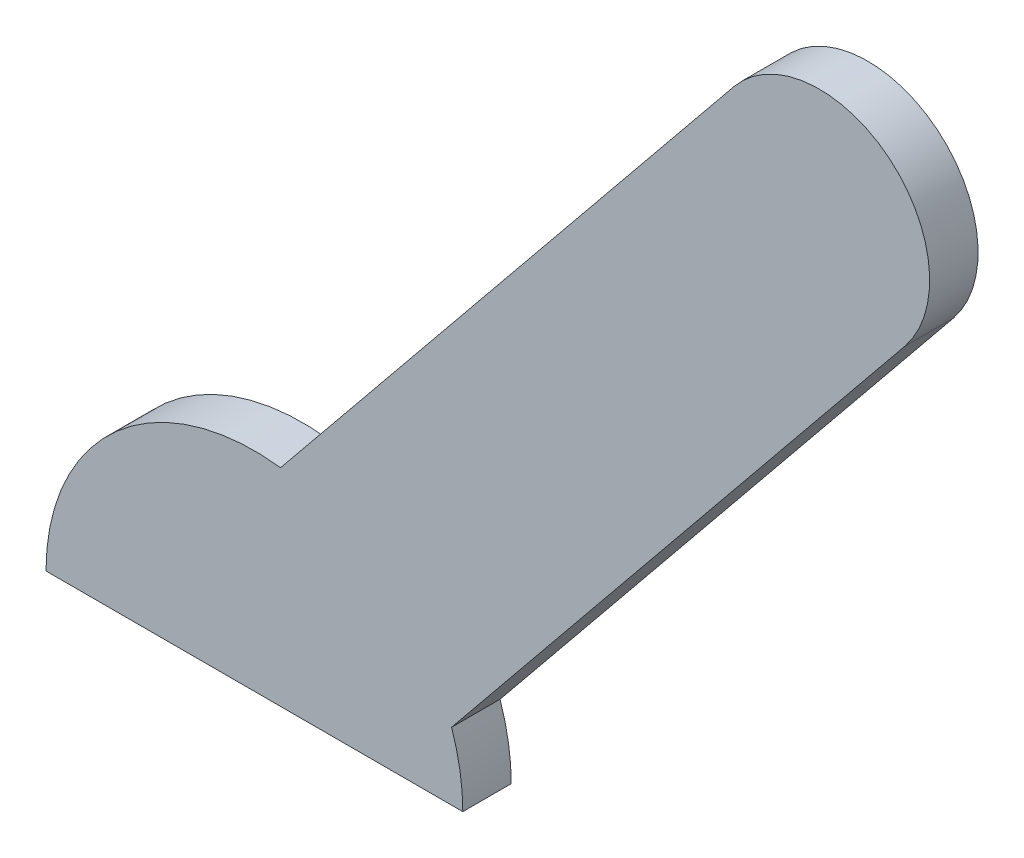
from build123d import *

# Parameters (mm, degrees)
BOSS_EXTRUDE2_DEPTH = 2.54


with BuildPart() as part:
    # Sketch1 → Boss-Extrude2 (new body)
    with BuildSketch(Plane.XY):
        with BuildLine():
            ThreePointArc((10.926168191, 0), (10.777925696, 1.79373048), (10.337220817, 3.538787522))
            Line((10.337220817, 3.538787522), (34.102376068, 32.722470445))
            ThreePointArc((34.102376068, 32.722470445), (33.270057491, 40.855731781), (25.136796156, 40.023413204))
            Line((25.136796156, 40.023413204), (1.371640905, 10.839730281))
            ThreePointArc((1.371640905, 10.839730281), (-7.224762007, 8.196582537), (-10.926168191, 0))
            Line((-10.926168191, 0), (10.926168191, 0))
        make_face()
    extrude(amount=BOSS_EXTRUDE2_DEPTH)


solid = part.part
